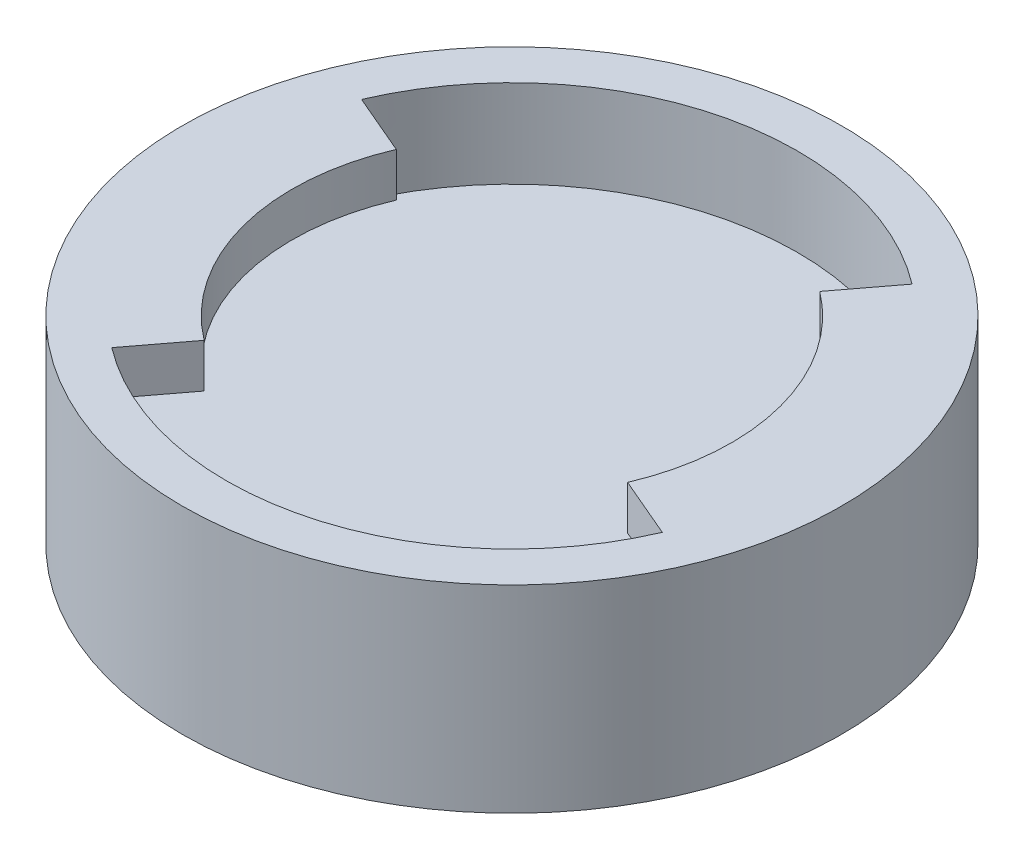
from build123d import *

# Parameters (mm, degrees)
SKIZZE1_R                       = 15
AUFSATZ_LINEAR_AUSTRAGEN1_DEPTH = 5
AUFSATZ_LINEAR_START            = 4
SKIZZE2_R                       = 15
SKIZZE2_R_2                     = 13
AUFSATZ_LINEAR_AUSTRAGEN2_DEPTH = 4
AUFSATZ_LINEAR_AUSTRAGEN3_DEPTH = 2


with BuildPart() as part:
    # Skizze1 → Aufsatz-Linear austragen1 (new body)
    with BuildSketch(Plane(origin=(0, 0, 0), x_dir=(1, 0, 0), z_dir=(0, 1, 0))):
        Circle(SKIZZE1_R)
    extrude(amount=-AUFSATZ_LINEAR_AUSTRAGEN1_DEPTH)

    # Skizze2 → Aufsatz-Linear austragen2 (add)
    with BuildSketch(Plane(origin=(0, 0, 0), x_dir=(1, 0, 0), z_dir=(0, 1, 0)).offset(AUFSATZ_LINEAR_START)):
        Circle(SKIZZE2_R)
        Circle(SKIZZE2_R_2, mode=Mode.SUBTRACT)
    extrude(amount=-AUFSATZ_LINEAR_AUSTRAGEN2_DEPTH)

    # Skizze3 → Aufsatz-Linear austragen3 (add)
    with BuildSketch(Plane(origin=(0, 4, 0), x_dir=(1, 0, 0), z_dir=(0, 1, 0))):
        with BuildLine():
            Line((-6.042078394, -7.968267609), (-7.854701912, -10.358747891))
            ThreePointArc((-7.854701912, -10.358747891), (-12.566291217, -3.329913671), (-11.953670509, 5.109771166))
            Line((-11.953670509, 5.109771166), (-9.195131161, 3.930593205))
            ThreePointArc((-9.195131161, 3.930593205), (-9.666377859, -2.561472055), (-6.042078394, -7.968267609))
        make_face()
        with BuildLine():
            Line((6.042078394, 7.968267609), (7.854701912, 10.358747891))
            ThreePointArc((7.854701912, 10.358747891), (12.566291217, 3.329913671), (11.953670509, -5.109771166))
            Line((11.953670509, -5.109771166), (9.195131161, -3.930593205))
            ThreePointArc((9.195131161, -3.930593205), (9.666377859, 2.561472055), (6.042078394, 7.968267609))
        make_face()
    extrude(amount=-AUFSATZ_LINEAR_AUSTRAGEN3_DEPTH)


solid = part.part
